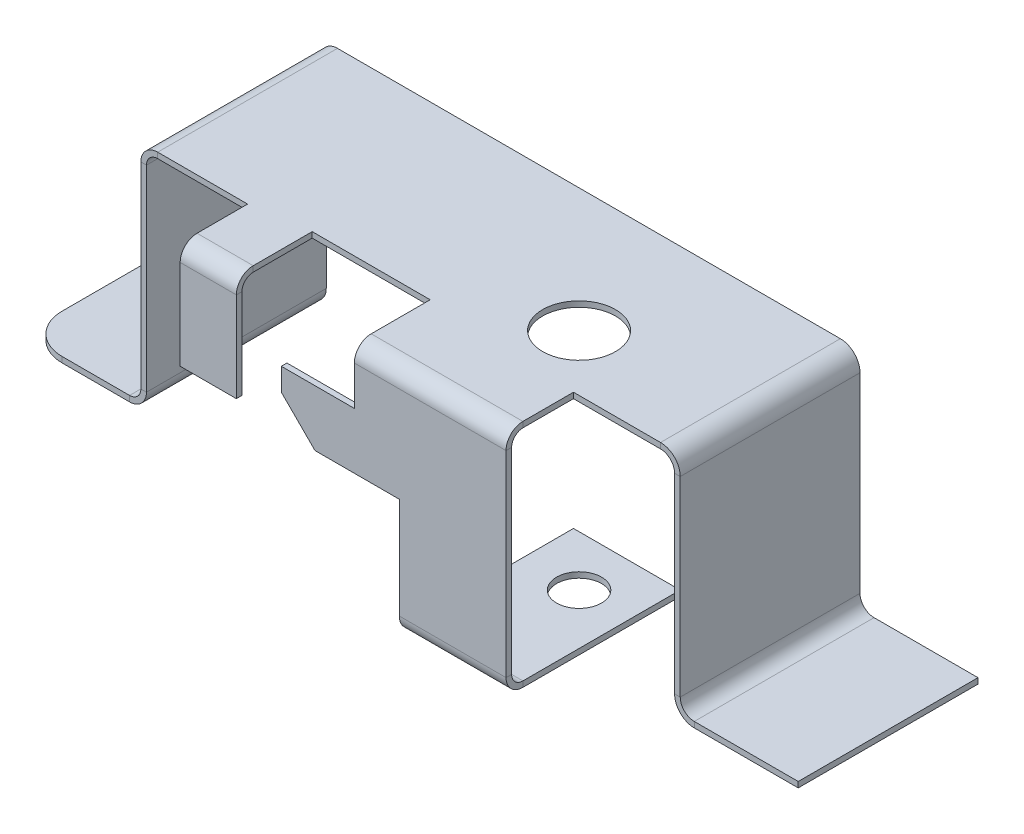
from build123d import *

# Parameters (mm, degrees)
BASE_FLANGE1_DEPTH           = 1
EDGE_FLANGE2_STRIP_W         = 8
EDGE_FLANGE2_STRIP_H         = 1
EDGE_FLANGE2_STRIP_CUT_DEPTH = 32
EDGE_FLANGE2_DEPTH           = 32
EDGE_FLANGE3_STRIP_W         = 8
EDGE_FLANGE3_STRIP_H         = 1
EDGE_FLANGE3_STRIP_CUT_DEPTH = 32
EDGE_FLANGE3_DEPTH           = 32
BASE_FLANGE2_DEPTH           = 10
SKETCH28_W                   = 30.5
SKETCH28_H                   = 1
BASE_FLANGE3_DEPTH           = 21
BASE_FLANGE4_DEPTH           = 8
TAB1_DEPTH                   = 1
BASE_FLANGE5_DEPTH           = 19
SKETCH41_W                   = 32
SKETCH41_H                   = 1
BASE_FLANGE6_DEPTH           = 19
EDGE_FLANGE4_STRIP_W         = 9
EDGE_FLANGE4_STRIP_H         = 1
EDGE_FLANGE4_STRIP_CUT_DEPTH = 32
EDGE_FLANGE4_DEPTH           = 32
EDGE_FLANGE5_STRIP_W         = 9
EDGE_FLANGE5_STRIP_H         = 1
EDGE_FLANGE5_STRIP_CUT_DEPTH = 32
EDGE_FLANGE5_DEPTH           = 32
SKETCH52_R                   = 6.482448702
CUT_EXTRUDE1_DEPTH           = 10
SKETCH53_R                   = 4
CUT_EXTRUDE2_DEPTH           = 10


# Read off the part's stored shape, not the designer's step: Base-Flange2
# Sheet-metal steps are written as plain solids
with BuildPart() as part:
    # Sketch1 → Base-Flange1 (new body)
    with BuildSketch(Plane(origin=(0, 0, 0), x_dir=(1, 0, 0), z_dir=(0, 1, 0))):
        with BuildLine():
            Line((-33.194191811, -9), (-33.194191811, 9))
            ThreePointArc((-33.194191811, 9), (-31.14393928, 13.949747468), (-26.194191811, 16))
            Line((-26.194191811, 16), (-11.194191811, 16))
            Line((-11.194191811, 16), (-11.194191811, -16))
            Line((-11.194191811, -16), (-26.194191811, -16))
            ThreePointArc((-26.194191811, -16), (-31.14393928, -13.949747468), (-33.194191811, -9))
        make_face()
    extrude(amount=-BASE_FLANGE1_DEPTH)

    # Edge-Flange2 strip (across the edge) → Edge-Flange2 strip cut (cut)
    with BuildSketch(Plane(origin=(-11.194191811, 0, 16), x_dir=(-1, 0, 0), z_dir=(0, 0, -1))):
        with Locations((-1, -0.5)):
            Rectangle(EDGE_FLANGE2_STRIP_W, EDGE_FLANGE2_STRIP_H)
    extrude(amount=EDGE_FLANGE2_STRIP_CUT_DEPTH, mode=Mode.SUBTRACT)

    # Edge-Flange2 section (across the edge) → Edge-Flange2 (add)
    with BuildSketch(Plane(origin=(-11.194191811, 0, 16), x_dir=(-1, 0, 0), z_dir=(0, 0, -1))):
        with BuildLine():
            Line((0, 2), (0, 40))
            Line((0, 40), (1, 40))
            Line((1, 40), (1, 2))
            ThreePointArc((1, 2), (1.585786438, 0.585786438), (3, 0))
            Line((3, 0), (3, -1))
            ThreePointArc((3, -1), (0.878679656, -0.121320344), (0, 2))
        make_face()
    extrude(amount=EDGE_FLANGE2_DEPTH)

    # Edge-Flange3 strip (across the edge) → Edge-Flange3 strip cut (cut)
    with BuildSketch(Plane(origin=(-11.194191811, 40, -16), x_dir=(0, -1, 0), z_dir=(0, 0, 1))):
        with Locations((-1, -0.5)):
            Rectangle(EDGE_FLANGE3_STRIP_W, EDGE_FLANGE3_STRIP_H)
    extrude(amount=EDGE_FLANGE3_STRIP_CUT_DEPTH, mode=Mode.SUBTRACT)

    # Edge-Flange3 section (across the edge) → Edge-Flange3 (add)
    with BuildSketch(Plane(origin=(-11.194191811, 40, -16), x_dir=(0, -1, 0), z_dir=(0, 0, 1))):
        with BuildLine():
            Line((0, 2), (0, 18))
            Line((0, 18), (1, 18))
            Line((1, 18), (1, 2))
            ThreePointArc((1, 2), (1.585786438, 0.585786438), (3, 0))
            Line((3, 0), (3, -1))
            ThreePointArc((3, -1), (0.878679656, -0.121320344), (0, 2))
        make_face()
    extrude(amount=EDGE_FLANGE3_DEPTH)


with BuildPart() as body_2:
    # Base-Flange2 outline → Base-Flange2 (new body)
    with BuildSketch(Plane(origin=(6.805808189, 0, 0), x_dir=(0, 0, -1), z_dir=(1, 0, 0))):
        with BuildLine():
            Line((-28, 37), (-28, 21))
            Line((-28, 21), (-27, 21))
            Line((-27, 21), (-27, 37))
            ThreePointArc((-27, 37), (-26.414213562, 38.414213562), (-25, 39))
            Line((-25, 39), (16, 39))
            Line((16, 39), (16, 40))
            Line((16, 40), (-25, 40))
            ThreePointArc((-25, 40), (-27.121320344, 39.121320344), (-28, 37))
        make_face()
    extrude(amount=BASE_FLANGE2_DEPTH)


with BuildPart() as part_1:
    add(part.part)

    # Combine1: union body 2
    add(body_2.part)


with BuildPart() as body_2_2:
    # Sketch28 → Base-Flange3 (new body)
    with BuildSketch(Plane(origin=(16.805808189, 0, 0), x_dir=(0, 0, -1), z_dir=(1, 0, 0))):
        with Locations((0.75, 39.5)):
            Rectangle(SKETCH28_W, SKETCH28_H)
    extrude(amount=BASE_FLANGE3_DEPTH)


with BuildPart() as body_3:
    # Sketch31 → Base-Flange4 (new body)
    with BuildSketch(Plane(origin=(37.805808189, 0, 0), x_dir=(0, 0, -1), z_dir=(1, 0, 0))):
        with BuildLine():
            Line((16, 39), (-25, 39))
            ThreePointArc((-25, 39), (-26.414213562, 38.414213562), (-27, 37))
            Line((-27, 37), (-27, 30))
            Line((-27, 30), (-28, 30))
            Line((-28, 30), (-28, 37))
            ThreePointArc((-28, 37), (-27.121320344, 39.121320344), (-25, 40))
            Line((-25, 40), (16, 40))
            Line((16, 40), (16, 39))
        make_face()
    extrude(amount=BASE_FLANGE4_DEPTH)

    # Sketch34 → Tab1 (add)
    with BuildSketch(Plane.XY.offset(28)):
        Polygon((45.805808189, 30), (24.805808189, 30), (24.805808189, 26), (30.805808189, 20), (45.805808189, 20), align=None)
    extrude(amount=-TAB1_DEPTH)


with BuildPart() as body_4:
    # Sketch38 → Base-Flange5 (new body)
    with BuildSketch(Plane(origin=(45.805808189, 0, 0), x_dir=(0, 0, -1), z_dir=(1, 0, 0))):
        with BuildLine():
            Line((16, 39), (-25, 39))
            ThreePointArc((-25, 39), (-26.414213562, 38.414213562), (-27, 37))
            Line((-27, 37), (-27, 2))
            ThreePointArc((-27, 2), (-26.414213562, 0.585786438), (-25, 0))
            Line((-25, 0), (3, 0))
            Line((3, 0), (3, -1))
            Line((3, -1), (-25, -1))
            ThreePointArc((-25, -1), (-27.121320344, -0.121320344), (-28, 2))
            Line((-28, 2), (-28, 37))
            ThreePointArc((-28, 37), (-27.121320344, 39.121320344), (-25, 40))
            Line((-25, 40), (16, 40))
            Line((16, 40), (16, 39))
        make_face()
    extrude(amount=BASE_FLANGE5_DEPTH)


with BuildPart() as body_5:
    # Sketch41 → Base-Flange6 (new body)
    with BuildSketch(Plane(origin=(64.805808189, 0, 0), x_dir=(0, 0, -1), z_dir=(1, 0, 0))):
        with Locations((0, 39.5)):
            Rectangle(SKETCH41_W, SKETCH41_H)
    extrude(amount=BASE_FLANGE6_DEPTH)

    # Edge-Flange4 strip (across the edge) → Edge-Flange4 strip cut (cut)
    with BuildSketch(Plane(origin=(83.805808189, 39, -16), x_dir=(-1, 0, 0), z_dir=(0, 0, 1))):
        with Locations((-1, -0.5)):
            Rectangle(EDGE_FLANGE4_STRIP_W, EDGE_FLANGE4_STRIP_H)
    extrude(amount=EDGE_FLANGE4_STRIP_CUT_DEPTH, mode=Mode.SUBTRACT)

    # Edge-Flange4 section (across the edge) → Edge-Flange4 (add)
    with BuildSketch(Plane(origin=(83.805808189, 39, -16), x_dir=(-1, 0, 0), z_dir=(0, 0, 1))):
        with BuildLine():
            Line((0, 2.5), (0, 40))
            Line((0, 40), (1, 40))
            Line((1, 40), (1, 2.5))
            ThreePointArc((1, 2.5), (1.732233047, 0.732233047), (3.5, 0))
            Line((3.5, 0), (3.5, -1))
            ThreePointArc((3.5, -1), (1.025126266, 0.025126266), (0, 2.5))
        make_face()
    extrude(amount=EDGE_FLANGE4_DEPTH)

    # Edge-Flange5 strip (across the edge) → Edge-Flange5 strip cut (cut)
    with BuildSketch(Plane(origin=(83.805808189, -1, 16), x_dir=(0, 1, 0), z_dir=(0, 0, -1))):
        with Locations((-1, -0.5)):
            Rectangle(EDGE_FLANGE5_STRIP_W, EDGE_FLANGE5_STRIP_H)
    extrude(amount=EDGE_FLANGE5_STRIP_CUT_DEPTH, mode=Mode.SUBTRACT)

    # Edge-Flange5 section (across the edge) → Edge-Flange5 (add)
    with BuildSketch(Plane(origin=(83.805808189, -1, 16), x_dir=(0, 1, 0), z_dir=(0, 0, -1))):
        with BuildLine():
            Line((0, 2.5), (0, 21))
            Line((0, 21), (1, 21))
            Line((1, 21), (1, 2.5))
            ThreePointArc((1, 2.5), (1.732233047, 0.732233047), (3.5, 0))
            Line((3.5, 0), (3.5, -1))
            ThreePointArc((3.5, -1), (1.025126266, 0.025126266), (0, 2.5))
        make_face()
    extrude(amount=EDGE_FLANGE5_DEPTH)


with BuildPart() as body_2_2_1:
    add(body_2_2.part)

    # Combine2: union body 3, body 4, body 5, part
    add(body_3.part)
    add(body_4.part)
    add(body_5.part)
    add(part_1.part)

    # Sketch52 → Cut-Extrude1 (cut)
    with BuildSketch(Plane(origin=(0, 40, 0), x_dir=(1, 0, 0), z_dir=(0, 1, 0))):
        with Locations(Location((55.805808189, -6, 0), (0, 0, 270))):
            Circle(SKETCH52_R)
    extrude(amount=-CUT_EXTRUDE1_DEPTH, mode=Mode.SUBTRACT)

    # Sketch53 → Cut-Extrude2 (cut)
    with BuildSketch(Plane(origin=(0, 0, 0), x_dir=(1, 0, 0), z_dir=(0, 1, 0))):
        with Locations(Location((55.805808189, -6, 0), (0, 0, 270))):
            Circle(SKETCH53_R)
    extrude(amount=-CUT_EXTRUDE2_DEPTH, mode=Mode.SUBTRACT)


solid = body_2_2_1.part
